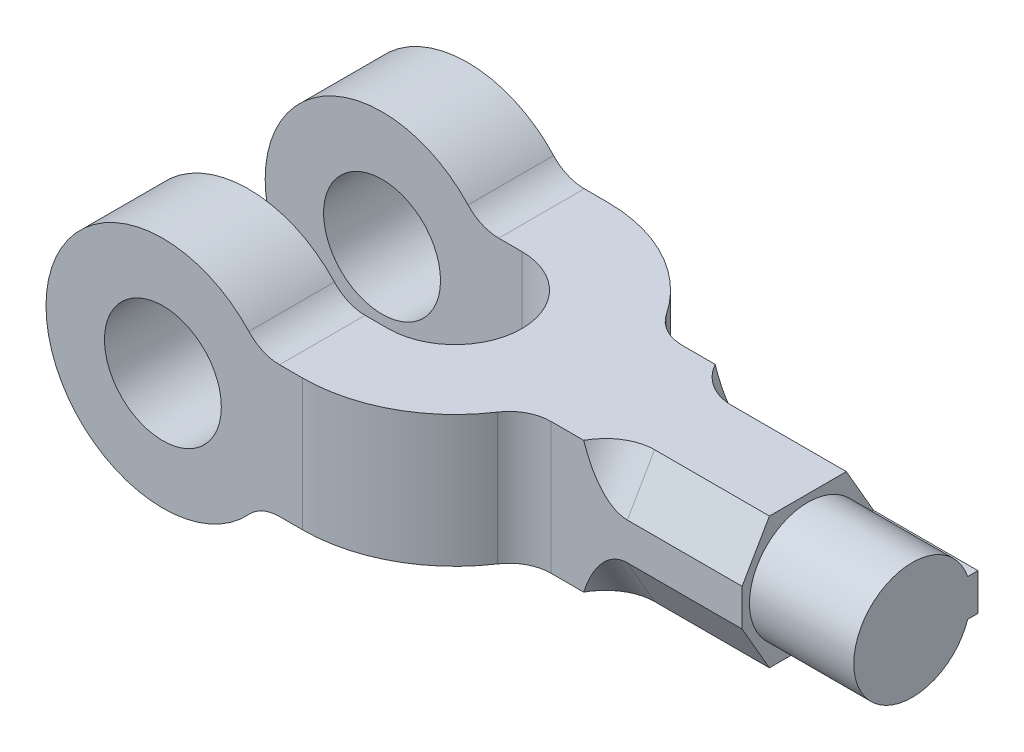
from build123d import *

# Parameters (mm, degrees)
SKETCH2_R                = 56
SKETCH2_R_2              = 28
BOSS_EXTRUDE1_DEPTH      = 41
BOSS_EXTRUDE2_DEPTH      = 31.5
BOSS_EXTRUDE3_REACH      = 173.122
BOSS_EXTRUDE3_END_RADIUS = 56
SKETCH4_W                = 41
SKETCH4_H                = 63
FILLET1_R                = 20
BOSS_EXTRUDE4_REACH      = 317.317
BOSS_EXTRUDE4_END_RADIUS = 73
SKETCH6_W                = 63
SKETCH6_H                = 63
FILLET2_R                = 20
SKETCH7_R                = 28
BOSS_EXTRUDE5_DEPTH      = 50
SKETCH8_R                = 50
CUT_EXTRUDE1_DEPTH       = 80
FILLET3_R                = 25
BOSS_EXTRUDE6_DEPTH      = 50


with BuildPart() as part:
    # Sketch2 → Boss-Extrude1 (new body)
    with BuildSketch(Plane.XY):
        Circle(SKETCH2_R)
        Circle(SKETCH2_R_2, mode=Mode.SUBTRACT)
    extrude(amount=BOSS_EXTRUDE1_DEPTH)


with BuildPart() as body_2:
    # Mirror4: mirrored copy
    add(part.part.mirror(Plane(origin=(0, 0, -32), x_dir=(1, 0, 0), z_dir=(0, 0, -1))))


with BuildPart() as body_3:
    # Sketch3 → Boss-Extrude2 (new, symmetric)
    with BuildSketch(Plane(origin=(0, 0, 0), x_dir=(1, 0, 0), z_dir=(0, 1, 0))):
        with BuildLine():
            Line((66.971041272, 105), (66.971041272, 64))
            ThreePointArc((66.971041272, 64), (98.971041272, 32), (66.971041272, 0))
            Line((66.971041272, 0), (66.971041272, -41))
            ThreePointArc((66.971041272, -41), (139.971041272, 32), (66.971041272, 105))
        make_face()
    extrude(amount=BOSS_EXTRUDE2_DEPTH, both=True)


with BuildPart() as part_1:
    add(part.part)

    add(body_2.part)  # Boss-Extrude3 merges body 2

    add(body_3.part)  # Boss-Extrude3 merges body 3
    # Boss-Extrude3: up to this cylinder (the profile starts outside it)
    boss_extrude3_end = Plane(origin=(0, 0, -32), z_dir=(0, 0, 1)) * Cylinder(BOSS_EXTRUDE3_END_RADIUS, 564.244, mode=Mode.PRIVATE)
    # Sketch4 → Boss-Extrude3 (add, up to the surface)
    with BuildSketch(Plane.ZY.offset(-66.971041272), mode=Mode.PRIVATE) as boss_extrude3_sk1:
        with Locations((20.5, 0)):
            Rectangle(SKETCH4_W, SKETCH4_H)
    boss_extrude3_tool1 = extrude(boss_extrude3_sk1.sketch, amount=BOSS_EXTRUDE3_REACH, mode=Mode.PRIVATE) - boss_extrude3_end
    add(boss_extrude3_tool1.solids().sort_by_distance((66.971041, 0, 20.5))[0])
    # Sketch4 → Boss-Extrude3 (add, up to the surface)
    with BuildSketch(Plane.ZY.offset(-66.971041272), mode=Mode.PRIVATE) as boss_extrude3_sk2:
        with Locations((-84.5, 0)):
            Rectangle(SKETCH4_W, SKETCH4_H)
    boss_extrude3_tool2 = extrude(boss_extrude3_sk2.sketch, amount=BOSS_EXTRUDE3_REACH, mode=Mode.PRIVATE) - boss_extrude3_end
    add(boss_extrude3_tool2.solids().sort_by_distance((66.971041, 0, -84.5))[0])

    # Fillet1
    fillet1_edges = [part_1.edges().sort_by_distance(p)[0] for p in [
        (46.300647944, 31.5, 20.5),
        (46.300647944, -31.5, 20.5),
        (46.300647944, -31.5, -84.5),
        (46.300647944, 31.5, -84.5),
    ]]
    fillet(fillet1_edges, radius=FILLET1_R)

    # Boss-Extrude4: up to this cylinder (the profile starts outside it)
    boss_extrude4_end = Plane(origin=(66.971041272, 0, -32), z_dir=(0, -1, 0)) * Cylinder(BOSS_EXTRUDE4_END_RADIUS, 781.634, mode=Mode.PRIVATE)
    # Sketch6 → Boss-Extrude4 (add, up to the surface)
    with BuildSketch(Plane(origin=(236, 0, 0), x_dir=(0, 0, -1), z_dir=(1, 0, 0)), mode=Mode.PRIVATE) as boss_extrude4_sk1:
        with Locations((32, 0)):
            Rectangle(SKETCH6_W, SKETCH6_H)
    boss_extrude4_tool1 = extrude(boss_extrude4_sk1.sketch, amount=-BOSS_EXTRUDE4_REACH, mode=Mode.PRIVATE) - boss_extrude4_end
    add(boss_extrude4_tool1.solids().sort_by_distance((236, 0, -32))[0])

    # Fillet2
    fillet2_edges = [part_1.edges().sort_by_distance(p)[0] for p in [
        (132.825046465, 0, -0.5),
        (132.825046465, 0, -63.5),
    ]]
    fillet(fillet2_edges, radius=FILLET2_R)

    # Sketch7 → Boss-Extrude5 (add)
    with BuildSketch(Plane(origin=(236, 0, 0), x_dir=(0, 0, -1), z_dir=(1, 0, 0))):
        with Locations((32, 0)):
            Circle(SKETCH7_R)
    extrude(amount=BOSS_EXTRUDE5_DEPTH)

    # Sketch8 → Cut-Extrude1 (cut)
    with BuildSketch(Plane(origin=(236, 0, 0), x_dir=(0, 0, -1), z_dir=(1, 0, 0))):
        with Locations((32, 0)):
            Circle(SKETCH8_R)
        Polygon((68.618122977, 0), (50.309061489, 31.712224737), (13.690938511, 31.712224737), (-4.618122977, 0), (13.690938511, -31.712224737), (50.309061489, -31.712224737), align=None, mode=Mode.SUBTRACT)
    extrude(amount=-CUT_EXTRUDE1_DEPTH, mode=Mode.SUBTRACT)

    # Fillet3
    # the kernel refuses this fillet: 25 mm, written as the material it adds along each edge
    with BuildSketch(Plane(origin=(156, -45.2617387, -94.75), x_dir=(0, 0.5000000000000009, -0.866025403784438), z_dir=(0, 0.8660254037844382, 0.500000000000001))) as fillet3_piece_1_section:
        with BuildLine():
            CenterArc((FILLET3_R, -FILLET3_R), FILLET3_R, 90, 90)
            Line((0, -FILLET3_R), (0, 0))
            Line((0, 0), (FILLET3_R, 0))
        make_face()
    fillet3_piece_1 = extrude(amount=151.136821004, mode=Mode.PRIVATE)
    fillet3_piece_1 = split(fillet3_piece_1, bisect_by=Plane(origin=(163.326286351, 23.024042198, -63.5), z_dir=(0, 0, 1)), keep=Keep.TOP, mode=Mode.PRIVATE)
    fillet3_piece_1 = split(fillet3_piece_1, bisect_by=Plane(origin=(163.326286351, 31.5, -58.606403481), z_dir=(0, -1, 0)), keep=Keep.TOP, mode=Mode.PRIVATE)
    add(fillet3_piece_1)
    with BuildSketch(Plane(origin=(156, -85.626587737, -19.181589498), x_dir=(0, -0.49999999999999484, -0.8660254037844416), z_dir=(0, 0.8660254037844417, -0.49999999999999484))) as fillet3_piece_2_section:
        with BuildLine():
            CenterArc((FILLET3_R, -FILLET3_R), FILLET3_R, 90, 90)
            Line((0, -FILLET3_R), (0, 0))
            Line((0, 0), (FILLET3_R, 0))
        make_face()
    fillet3_piece_2 = extrude(amount=151.136821004, mode=Mode.PRIVATE)
    fillet3_piece_2 = split(fillet3_piece_2, bisect_by=Plane(origin=(163.326286351, -31.5, -58.606403481), z_dir=(0, 1, 0)), keep=Keep.TOP, mode=Mode.PRIVATE)
    fillet3_piece_2 = split(fillet3_piece_2, bisect_by=Plane(origin=(163.326286351, -23.024042198, -63.5), z_dir=(0, 0, 1)), keep=Keep.TOP, mode=Mode.PRIVATE)
    add(fillet3_piece_2)
    with BuildSketch(Plane(origin=(156, 85.626587737, -44.818410502), x_dir=(1, 0, 0), z_dir=(0, -0.8660254037844416, 0.49999999999999506))) as fillet3_piece_3_section:
        with BuildLine():
            CenterArc((FILLET3_R, FILLET3_R), FILLET3_R, 180, 90)
            Line((0, FILLET3_R), (0, 0))
            Line((0, 0), (FILLET3_R, 0))
        make_face()
    fillet3_piece_3 = extrude(amount=151.136821004, mode=Mode.PRIVATE)
    fillet3_piece_3 = split(fillet3_piece_3, bisect_by=Plane(origin=(163.326286352, 23.024042197, -0.5), z_dir=(0, 0, -1)), keep=Keep.TOP, mode=Mode.PRIVATE)
    fillet3_piece_3 = split(fillet3_piece_3, bisect_by=Plane(origin=(163.326286352, 31.5, -5.393596519), z_dir=(0, -1, 0)), keep=Keep.TOP, mode=Mode.PRIVATE)
    add(fillet3_piece_3)
    with BuildSketch(Plane(origin=(156, 45.2617387, 30.75), x_dir=(1, 0, 0), z_dir=(0, -0.8660254037844346, -0.5000000000000071))) as fillet3_piece_4_section:
        with BuildLine():
            CenterArc((FILLET3_R, FILLET3_R), FILLET3_R, 180, 90)
            Line((0, FILLET3_R), (0, 0))
            Line((0, 0), (FILLET3_R, 0))
        make_face()
    fillet3_piece_4 = extrude(amount=151.136821004, mode=Mode.PRIVATE)
    fillet3_piece_4 = split(fillet3_piece_4, bisect_by=Plane(origin=(163.326286352, -31.5, -5.393596519), z_dir=(0, 1, 0)), keep=Keep.TOP, mode=Mode.PRIVATE)
    fillet3_piece_4 = split(fillet3_piece_4, bisect_by=Plane(origin=(163.326286352, -23.024042197, -0.5), z_dir=(0, 0, -1)), keep=Keep.TOP, mode=Mode.PRIVATE)
    add(fillet3_piece_4)

    # Sketch9 → Boss-Extrude6 (add)
    with BuildSketch(Plane(origin=(236, 0, 0), x_dir=(0, 0, -1), z_dir=(1, 0, 0))):
        with BuildLine():
            Line((58.559639523, 8.864849036), (63.5, 8.864849036))
            Line((63.5, 8.864849036), (63.5, -8.864849036))
            Line((63.5, -8.864849036), (58.559639523, -8.864849036))
            ThreePointArc((58.559639523, -8.864849036), (60, 0), (58.559639523, 8.864849036))
        make_face()
    extrude(amount=BOSS_EXTRUDE6_DEPTH)


solid = part_1.part
